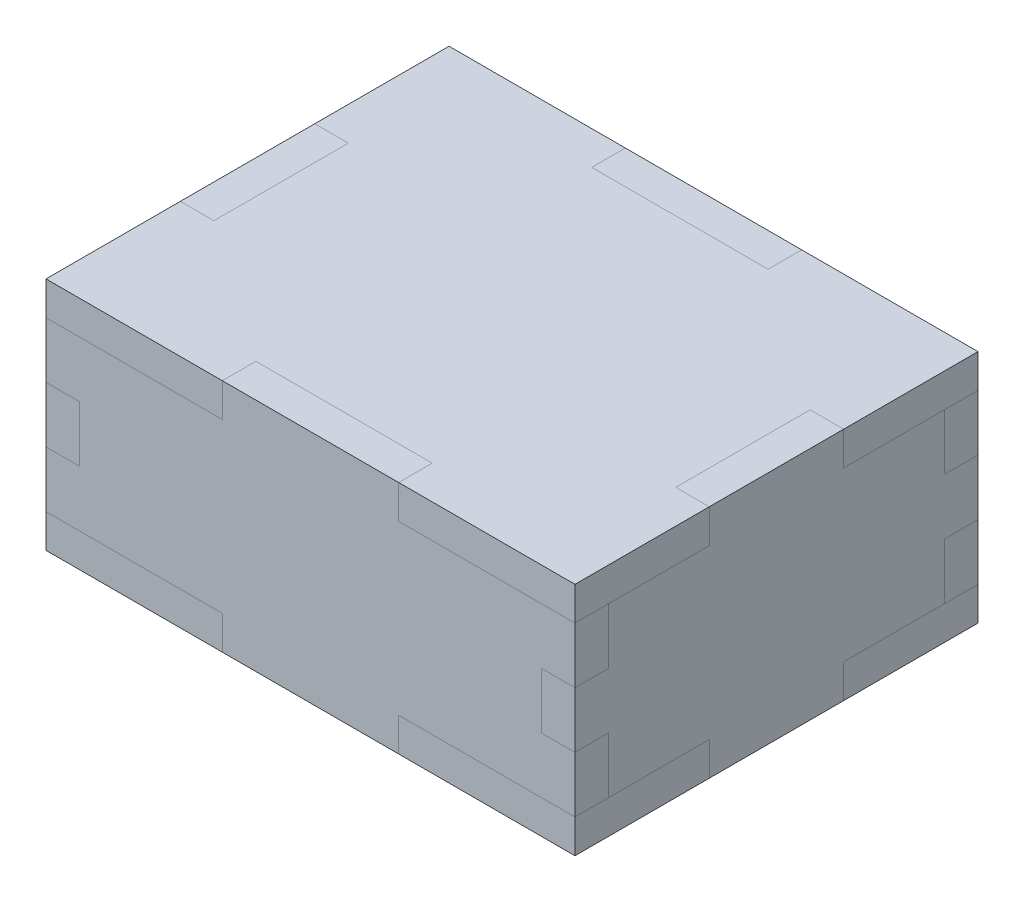
from build123d import *

# Parameters (mm, degrees)
SKETCH1_W             = 80.01
SKETCH1_H             = 60.96
BOSS_EXTRUDE2_DEPTH   = 5.08
SKETCH2_W             = 20.32
SKETCH2_H             = 5.08
CUT_EXTRUDE1_DEPTH    = 5.08
SKETCH3_W             = 20.32
SKETCH3_H             = 5.08
CUT_EXTRUDE2_DEPTH    = 5.08
SKETCH4_W             = 26.67
SKETCH4_H             = 5.08
CUT_EXTRUDE3_DEPTH    = 5.08
SKETCH5_W             = 26.67
SKETCH5_H             = 5.08
CUT_EXTRUDE4_DEPTH    = 5.08
SKETCH6_W             = 80.01
SKETCH6_H             = 25.4
BOSS_EXTRUDE3_DEPTH   = 5.08
SKETCH7_W             = 26.67
SKETCH7_H             = 5.08
BOSS_EXTRUDE4_DEPTH   = 5.08
BODY_MOVE_COPY1_ANGLE = 90
CIRPATTERN1_COUNT     = 2
SKETCH8_W             = 5.08
SKETCH8_H             = 8.466666666
CUT_EXTRUDE5_DEPTH    = 5.08
SKETCH10_W            = 5.08
SKETCH10_H            = 8.466666666
CUT_EXTRUDE7_DEPTH    = 5.08
SKETCH17_W            = 12.7
SKETCH17_H            = 15.24
CUT_EXTRUDE8_DEPTH    = 5.08
SKETCH18_W            = 26.67
SKETCH18_H            = 5.08
BOSS_EXTRUDE11_DEPTH  = 5.08
CIRPATTERN4_COUNT     = 2
SKETCH19_W            = 25.4
SKETCH19_H            = 50.8
BOSS_EXTRUDE12_DEPTH  = 5.08
SKETCH20_W            = 8.466666666
SKETCH20_H            = 5.08
BOSS_EXTRUDE13_DEPTH  = 5.08
SKETCH21_W            = 8.466666666
SKETCH21_H            = 5.08
BOSS_EXTRUDE14_DEPTH  = 5.08
SKETCH22_W            = 20.32
SKETCH22_H            = 5.08
BOSS_EXTRUDE15_DEPTH  = 5.08
SKETCH23_W            = 20.32
SKETCH23_H            = 5.08
BOSS_EXTRUDE16_DEPTH  = 5.08
BODY_MOVE_COPY4_ANGLE = 90
CIRPATTERN5_ANGLE     = 180
SKETCH24_W            = 17.78
SKETCH24_H            = 5.08
CUT_EXTRUDE9_DEPTH    = 5.08
CIRPATTERN6_COUNT     = 2
SKETCH25_W            = 17.78
SKETCH25_H            = 5.08
CUT_EXTRUDE10_DEPTH   = 5.08
CIRPATTERN7_COUNT     = 2
SKETCH28_W            = 5.08
SKETCH28_H            = 20.32
CUT_EXTRUDE11_DEPTH   = 5.08
CIRPATTERN8_COUNT     = 2


with BuildPart() as part:
    # Sketch1 → Boss-Extrude2 (new body)
    with BuildSketch(Plane(origin=(0, 0, 0), x_dir=(1, 0, 0), z_dir=(0, 1, 0))):
        with Locations((-40.005, 30.48)):
            Rectangle(SKETCH1_W, SKETCH1_H)
    extrude(amount=BOSS_EXTRUDE2_DEPTH)

    # Sketch2 → Cut-Extrude1 (cut)
    with BuildSketch(Plane(origin=(0, 0, 0), x_dir=(0, 0, -1), z_dir=(1, 0, 0))):
        with Locations((30.48, 2.54)):
            Rectangle(SKETCH2_W, SKETCH2_H)
    extrude(amount=-CUT_EXTRUDE1_DEPTH, mode=Mode.SUBTRACT)

    # Sketch3 → Cut-Extrude2 (cut)
    with BuildSketch(Plane.ZY.offset(80.01)):
        with Locations((-30.48, 2.54)):
            Rectangle(SKETCH3_W, SKETCH3_H)
    extrude(amount=-CUT_EXTRUDE2_DEPTH, mode=Mode.SUBTRACT)

    # Sketch4 → Cut-Extrude3 (cut)
    with BuildSketch(Plane.XY):
        with Locations((-40.005, 2.54)):
            Rectangle(SKETCH4_W, SKETCH4_H)
    extrude(amount=-CUT_EXTRUDE3_DEPTH, mode=Mode.SUBTRACT)

    # Sketch5 → Cut-Extrude4 (cut)
    with BuildSketch(Plane(origin=(0, 0, -60.96), x_dir=(-1, 0, 0), z_dir=(0, 0, -1))):
        with Locations((40.005, 2.54)):
            Rectangle(SKETCH5_W, SKETCH5_H)
    extrude(amount=-CUT_EXTRUDE4_DEPTH, mode=Mode.SUBTRACT)


with BuildPart() as body_2:
    # Sketch6 → Boss-Extrude3 (new body)
    with BuildSketch(Plane(origin=(0, 5.08, 0), x_dir=(1, 0, 0), z_dir=(0, 1, 0))):
        with Locations((-21.199489538, 114.542707296)):
            Rectangle(SKETCH6_W, SKETCH6_H)
    extrude(amount=BOSS_EXTRUDE3_DEPTH)

    # Sketch7 → Boss-Extrude4 (add)
    with BuildSketch(Plane.XY.offset(-101.842707296)):
        with Locations((-21.199489538, 7.62)):
            Rectangle(SKETCH7_W, SKETCH7_H)
    extrude(amount=BOSS_EXTRUDE4_DEPTH)


with BuildPart() as body_2_1:
    # Body-Move/Copy1: read off the stored shape, not the designer's step
    # Body-Move/Copy1: moved
    add(body_2.part.moved(Location((-18.8055105, -66.04, 96.7627073))).rotate(Axis((0, 0, 0), (1, 0, 0)), BODY_MOVE_COPY1_ANGLE))


with BuildPart() as cirpattern1_1:
    # CirPattern1: pattern copy
    add(body_2_1.part.rotate(Axis((-40.005, 0, -30.48), (0, 1, 0)), 1 * 360 / CIRPATTERN1_COUNT))


with BuildPart() as cut_extrude5_tool:
    # Sketch8 → Cut-Extrude5 (new body)
    with BuildSketch(Plane(origin=(0, 0, 0), x_dir=(0, 0, -1), z_dir=(1, 0, 0))):
        with Locations((2.54, 17.78)):
            Rectangle(SKETCH8_W, SKETCH8_H)
        with Locations((58.42, 17.78)):
            Rectangle(SKETCH8_W, SKETCH8_H)
    extrude(amount=-CUT_EXTRUDE5_DEPTH)


with BuildPart() as body_2_2:
    add(body_2_1.part)

    # Cut-Extrude5: cut by cut_extrude5_tool
    add(cut_extrude5_tool.part, mode=Mode.SUBTRACT)


with BuildPart() as cirpattern1_1_1:
    add(cirpattern1_1.part)

    # Cut-Extrude5: cut by cut_extrude5_tool
    add(cut_extrude5_tool.part, mode=Mode.SUBTRACT)


with BuildPart() as cut_extrude7_tool:
    # Sketch10 → Cut-Extrude7 (new body)
    with BuildSketch(Plane.ZY.offset(80.01)):
        with Locations((-58.42, 17.78)):
            Rectangle(SKETCH10_W, SKETCH10_H)
        with Locations((-2.54, 17.78)):
            Rectangle(SKETCH10_W, SKETCH10_H)
    extrude(amount=-CUT_EXTRUDE7_DEPTH)


with BuildPart() as body_2_3:
    add(body_2_2.part)

    # Cut-Extrude7: cut by cut_extrude7_tool
    add(cut_extrude7_tool.part, mode=Mode.SUBTRACT)

    # Sketch17 → Cut-Extrude8 (cut)
    with BuildSketch(Plane(origin=(0, 0, -60.96), x_dir=(-1, 0, 0), z_dir=(0, 0, -1))):
        with Locations((68.58, 14.393333333)):
            Rectangle(SKETCH17_W, SKETCH17_H)
    extrude(amount=-CUT_EXTRUDE8_DEPTH, mode=Mode.SUBTRACT)



with BuildPart() as cirpattern1_1_2:
    add(cirpattern1_1_1.part)

    # Cut-Extrude7: cut by cut_extrude7_tool
    add(cut_extrude7_tool.part, mode=Mode.SUBTRACT)


with BuildPart() as body_2_4:
    add(body_2_3.part)

    add(cirpattern1_1_2.part)  # Boss-Extrude11 merges CirPattern1_1
    # Sketch18 → Boss-Extrude11 (add)
    with BuildSketch(Plane(origin=(0, 30.48, 0), x_dir=(1, 0, 0), z_dir=(0, 1, 0))):
        with Locations((-40.005, 2.54)):
            Rectangle(SKETCH18_W, SKETCH18_H)
        with Locations((-40.005, 58.42)):
            Rectangle(SKETCH18_W, SKETCH18_H)
    extrude(amount=BOSS_EXTRUDE11_DEPTH)


with BuildPart() as cirpattern4_1:
    # CirPattern4: pattern copy
    add(part.part.rotate(Axis((-40.005, 17.78, 0), (0, 0, 1)), 1 * 360 / CIRPATTERN4_COUNT))


with BuildPart() as body_4:
    # Sketch19 → Boss-Extrude12 (new body)
    with BuildSketch(Plane(origin=(0, 5.08, 0), x_dir=(1, 0, 0), z_dir=(0, 1, 0))):
        with Locations((73.923166649, 30.277821877)):
            Rectangle(SKETCH19_W, SKETCH19_H)
    extrude(amount=BOSS_EXTRUDE12_DEPTH)

    # Sketch20 → Boss-Extrude13 (add)
    with BuildSketch(Plane(origin=(0, 0, -55.677821877), x_dir=(-1, 0, 0), z_dir=(0, 0, -1))):
        with Locations((-73.923166649, 7.62)):
            Rectangle(SKETCH20_W, SKETCH20_H)
    extrude(amount=BOSS_EXTRUDE13_DEPTH)

    # Sketch21 → Boss-Extrude14 (add)
    with BuildSketch(Plane.XY.offset(-4.877821877)):
        with Locations((73.923166649, 7.62)):
            Rectangle(SKETCH21_W, SKETCH21_H)
    extrude(amount=BOSS_EXTRUDE14_DEPTH)

    # Sketch22 → Boss-Extrude15 (add)
    with BuildSketch(Plane(origin=(86.623166649, 0, 0), x_dir=(0, 0, -1), z_dir=(1, 0, 0))):
        with Locations((30.277821877, 7.62)):
            Rectangle(SKETCH22_W, SKETCH22_H)
    extrude(amount=BOSS_EXTRUDE15_DEPTH)

    # Sketch23 → Boss-Extrude16 (add)
    with BuildSketch(Plane.ZY.offset(-61.223166649)):
        with Locations((-30.277821877, 7.62)):
            Rectangle(SKETCH23_W, SKETCH23_H)
    extrude(amount=BOSS_EXTRUDE16_DEPTH)


with BuildPart() as body_4_1:
    # Body-Move/Copy4: read off the stored shape, not the designer's step
    # Body-Move/Copy4: moved
    add(body_4.part.moved(Location((-56.1431666, -5.08, -0.2021781))).rotate(Axis((0, 0, 0), (0, 0, 1)), BODY_MOVE_COPY4_ANGLE))


with BuildPart() as body_5:
    # CirPattern5: read off the stored shape, not the designer's step
    # CirPattern5: copy of body 4
    add(body_4_1.part.moved(Location((80.01, 0, 60.96))).rotate(Axis((0, 0, 0), (0, 1, 0)), CIRPATTERN5_ANGLE))


with BuildPart() as part_1:
    add(part.part)

    # Sketch24 → Cut-Extrude9 (cut)
    with BuildSketch(Plane(origin=(0, 0, 0), x_dir=(-1, 0, 0), z_dir=(0, -1, 0))):
        with Locations((17.78, 49.953333333)):
            Rectangle(SKETCH24_W, SKETCH24_H)
    cut_extrude9 = extrude(amount=-CUT_EXTRUDE9_DEPTH, mode=Mode.SUBTRACT)

    # CirPattern6: Cut-Extrude9 ×2 about axis
    cirpattern6_axis = Axis((-40.470793413, 0, -30.071876248), (0, 1, 0))
    for i in range(1, CIRPATTERN6_COUNT):
        add(cut_extrude9.rotate(cirpattern6_axis, i * 360 / CIRPATTERN6_COUNT), mode=Mode.SUBTRACT)

    # Sketch25 → Cut-Extrude10 (cut)
    with BuildSketch(Plane(origin=(0, 0, 0), x_dir=(-1, 0, 0), z_dir=(0, -1, 0))):
        with Locations((62.23, 50.473004536)):
            Rectangle(SKETCH25_W, SKETCH25_H)
    cut_extrude10 = extrude(amount=-CUT_EXTRUDE10_DEPTH, mode=Mode.SUBTRACT)

    # CirPattern7: Cut-Extrude10 ×2 about axis
    cirpattern7_axis = Axis((-39.498449663, 0, -30.06050844), (0, 1, 0))
    for i in range(1, CIRPATTERN7_COUNT):
        add(cut_extrude10.rotate(cirpattern7_axis, i * 360 / CIRPATTERN7_COUNT), mode=Mode.SUBTRACT)

    # Sketch28 → Cut-Extrude11 (cut)
    with BuildSketch(Plane(origin=(0, 0, 0), x_dir=(-1, 0, 0), z_dir=(0, -1, 0))):
        with Locations((12.7, 30.48)):
            Rectangle(SKETCH28_W, SKETCH28_H)
    cut_extrude11 = extrude(amount=-CUT_EXTRUDE11_DEPTH, mode=Mode.SUBTRACT)

    # CirPattern8: Cut-Extrude11 ×2 about axis
    cirpattern8_axis = Axis((-40.723067531, 0, -30.5179889), (0, 1, 0))
    for i in range(1, CIRPATTERN8_COUNT):
        add(cut_extrude11.rotate(cirpattern8_axis, i * 360 / CIRPATTERN8_COUNT), mode=Mode.SUBTRACT)


solid = Compound([body_2_4.part, cirpattern4_1.part, body_4_1.part, body_5.part, part_1.part])
